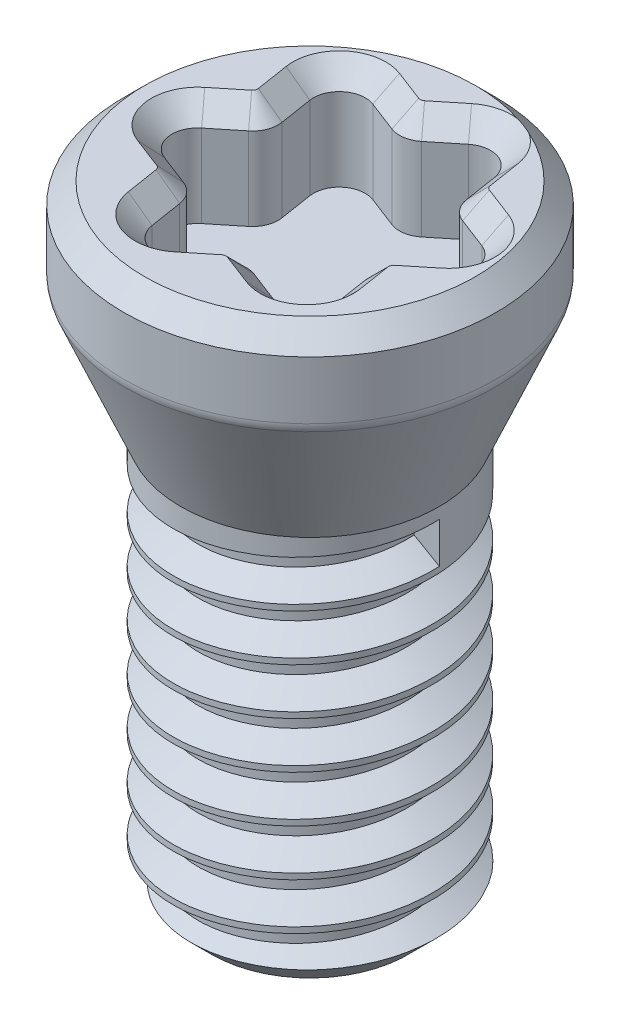
from build123d import *

# Parameters (mm, degrees)
FILETE1_R             = 0.2
CHANFRO1_SIZE         = 0.3
CORTE_EXTRUS_O1_DEPTH = 1
FILETE2_R             = 0.25
CHANFRO2_SIZE         = 0.2
ROSCA1_PITCH          = 0.45


with BuildPart() as part:
    # Esboço1 → Revolução1 (revolve)
    with BuildSketch(Plane.XY, mode=Mode.PRIVATE) as revolu_o1_sk:
        Polygon((0, 0), (1.25, 0), (1.25, 3.9), (1.8, 5.2), (1.8, 6), (0, 6), align=None)
    revolve(revolu_o1_sk.sketch.rotate(Axis((0, 0, 0), (0, 1, 0)), 90), axis=Axis((0, 0, 0), (0, 1, 0)))

    # Filete1
    filete1_edges = [part.edges().sort_by_distance(p)[0] for p in [
        (0, 5.2, 1.8),
    ]]
    fillet(filete1_edges, radius=FILETE1_R)

    # Chanfro1
    chanfro1_edges = [part.edges().sort_by_distance(p)[0] for p in [
        (0, 0, 1.25),
    ]]
    chamfer(chanfro1_edges, length=CHANFRO1_SIZE)

    # Esboço2 → Corte-extrusão1 (cut)
    with BuildSketch(Plane(origin=(0, 6, 0), x_dir=(1, 0, 0), z_dir=(0, 1, 0))):
        Polygon((1.574906763, 0.33480894), (-0.524001874, -1.36359694), (-0.945410194, 1.3033142), align=None)
        Polygon((0.594331671, 1.546614407), (1.015739991, -1.120296733), (-1.504576966, -0.151791473), align=None)
        Polygon((-0.804940754, 0.41434382), (-1.504576966, -0.151791473), (-0.664471314, -0.47462656), align=None)
        Polygon((0.175634338, -0.797461646), (-0.664471314, -0.47462656), (-0.524001874, -1.36359694), align=None)
        Polygon((0.875270551, -0.231326353), (0.175634338, -0.797461646), (1.015739991, -1.120296733), align=None)
        Polygon((1.574906763, 0.33480894), (0.734801111, 0.657644027), (0.875270551, -0.231326353), align=None)
        Polygon((0.594331671, 1.546614407), (-0.105304542, 0.980479113), (0.734801111, 0.657644027), align=None)
        Polygon((-0.945410194, 1.3033142), (-0.804940754, 0.41434382), (-0.105304542, 0.980479113), align=None)
    extrude(amount=-CORTE_EXTRUS_O1_DEPTH, mode=Mode.SUBTRACT)

    # Filete2
    filete2_edges = [part.edges().sort_by_distance(p)[0] for p in [
        (0.175634338, 5.5, 0.797461646),
        (-0.524001874, 5.5, 1.36359694),
        (-0.664471314, 5.5, 0.47462656),
        (-1.504576966, 5.5, 0.151791473),
        (-0.804940754, 5.5, -0.41434382),
        (-0.945410194, 5.5, -1.3033142),
        (-0.105304542, 5.5, -0.980479113),
        (0.594331671, 5.5, -1.546614407),
        (0.734801111, 5.5, -0.657644027),
        (1.574906763, 5.5, -0.33480894),
        (0.875270551, 5.5, 0.231326353),
        (1.015739991, 5.5, 1.120296733),
    ]]
    fillet(filete2_edges, radius=FILETE2_R)

    # Chanfro2
    # the kernel refuses this chamfer: 0.2 mm, written as the material it takes off along each edge
    with BuildSketch(Plane(origin=(0, 6, 0), x_dir=(0, 0, -1), z_dir=(1, 0, 0))) as chanfro2_piece_1:
        Polygon((1.8 - CHANFRO2_SIZE, 0), (1.8, -CHANFRO2_SIZE), (1.8, 0), align=None)
    revolve(axis=Axis((0, 6, 0), (0, 1, 0)), mode=Mode.SUBTRACT)
    with BuildSketch(Plane(origin=(-0.827468551, 6, -0.556912511), x_dir=(-0.9873714169859867, 0.02749587661058733, 0.1560181453821959), z_dir=(-0.15607715551522913, 0, -0.9877448666160078)), Plane(origin=(-0.541214173, 6, -1.147990097), x_dir=(0.35857003114067887, 0.027495876610587354, -0.9330978027716001), z_dir=(0.9334507247047489, 0, 0.3587056516814019)), Plane(origin=(-0.799203321, 6, 0.422851859), x_dir=(-0.3585700311406784, 0.027495876610587357, 0.9330978027716003), z_dir=(-0.933450724704749, 0, -0.35870565168140145)), Plane(origin=(-1.167964337, 6, -0.120590497), x_dir=(-0.6288013858453075, 0.02749587661058735, -0.7770796573894057), z_dir=(0.7773735691895212, 0, -0.6290392149346055)), Plane(origin=(0.063430128, 6, 0.888255636), x_dir=(0.6288013858453081, 0.027495876610587344, 0.7770796573894051), z_dir=(-0.7773735691895207, 0, 0.6290392149346061)), Plane(origin=(-0.591585265, 6, 0.935890866), x_dir=(-0.9873714169859867, 0.02749587661058736, 0.1560181453821959), z_dir=(-0.15607715551522913, 0, -0.9877448666160078)), Plane(origin=(0.897798348, 6, 0.373895044), x_dir=(0.9873714169859867, 0.02749587661058733, -0.15601814538219608), z_dir=(0.15607715551522933, 0, 0.9877448666160078)), Plane(origin=(0.61154397, 6, 0.96497263), x_dir=(-0.3585700311406784, 0.027495876610587357, 0.9330978027716003), z_dir=(-0.933450724704749, 0, -0.35870565168140145)), Plane(origin=(0.006899668, 6, -1.071273103), x_dir=(-0.6288013858453074, 0.027495876610587357, -0.7770796573894057), z_dir=(0.7773735691895212, 0, -0.6290392149346055)), Plane(origin=(0.661915062, 6, -1.118908333), x_dir=(0.9873714169859867, 0.02749587661058736, -0.1560181453821961), z_dir=(0.15607715551522933, 0, 0.9877448666160078)), Plane(origin=(0.869533117, 6, -0.605869326), x_dir=(0.35857003114067887, 0.027495876610587354, -0.9330978027716001), z_dir=(0.9334507247047489, 0, 0.3587056516814019)), Plane(origin=(1.238294133, 6, -0.06242697), x_dir=(0.6288013858453081, 0.027495876610587357, 0.7770796573894051), z_dir=(-0.7773735691895207, 0, 0.6290392149346061))) as chanfro2_piece_2:
        Polygon((CHANFRO2_SIZE * 0.999621916911, -CHANFRO2_SIZE * 0.0274958766106), (-CHANFRO2_SIZE * 0.0274958766106, -CHANFRO2_SIZE * 0.999621916911), (0, 0), align=None)
    extrude(amount=0.322649731, mode=Mode.SUBTRACT)
    with BuildSketch(Plane(origin=(-0.150360135, 6, -1.265616496), x_dir=(0.6290392149346056, 0, 0.7773735691895212), z_dir=(0.7773735691895212, 0, -0.6290392149346056))) as chanfro2_piece_3:
        Polygon((0.25 - CHANFRO2_SIZE, 0), (0.25, CHANFRO2_SIZE), (0.25, 0), align=None)
    revolve(axis=Axis((-0.150360135, 6, -1.265616496), (0, -1, 0)), revolution_arc=60, mode=Mode.SUBTRACT)
    with BuildSketch(Plane(origin=(-1.074404767, 6, -0.517893222), x_dir=(0.9877448666160078, 0, -0.1560771555152294), z_dir=(-0.1560771555152294, 0, -0.9877448666160078))) as chanfro2_piece_4:
        Polygon((0.25 - CHANFRO2_SIZE, 0), (0.25, CHANFRO2_SIZE), (0.25, 0), align=None)
    revolve(axis=Axis((-1.074404767, 6, -0.517893222), (0, -1, 0)), revolution_arc=60, mode=Mode.SUBTRACT)
    with BuildSketch(Plane(origin=(0.95920953, 6, -0.839232007), x_dir=(-0.35870565168140184, 0, 0.9334507247047489), z_dir=(0.9334507247047489, 0, 0.35870565168140184))) as chanfro2_piece_5:
        Polygon((0.25 - CHANFRO2_SIZE, 0), (0.25, CHANFRO2_SIZE), (0.25, 0), align=None)
    revolve(axis=Axis((0.95920953, 6, -0.839232007), (0, -1, 0)), revolution_arc=60, mode=Mode.SUBTRACT)
    with BuildSketch(Plane(origin=(1.144734564, 6, 0.334875755), x_dir=(-0.9877448666160077, 0, 0.15607715551522985), z_dir=(0.15607715551522985, 0, 0.9877448666160077))) as chanfro2_piece_6:
        Polygon((0.25 - CHANFRO2_SIZE, 0), (0.25, CHANFRO2_SIZE), (0.25, 0), align=None)
    revolve(axis=Axis((1.144734564, 6, 0.334875755), (0, -1, 0)), revolution_arc=60, mode=Mode.SUBTRACT)
    with BuildSketch(Plane(origin=(0.220689932, 6, 1.082599029), x_dir=(-0.6290392149346063, 0, -0.7773735691895205), z_dir=(-0.7773735691895205, 0, 0.6290392149346063))) as chanfro2_piece_7:
        Polygon((0.25 - CHANFRO2_SIZE, 0), (0.25, CHANFRO2_SIZE), (0.25, 0), align=None)
    revolve(axis=Axis((0.220689932, 6, 1.082599029), (0, -1, 0)), revolution_arc=60, mode=Mode.SUBTRACT)
    with BuildSketch(Plane(origin=(-0.888879734, 6, 0.65621454), x_dir=(0.3587056516814014, 0, -0.9334507247047491), z_dir=(-0.9334507247047491, 0, -0.3587056516814014))) as chanfro2_piece_8:
        Polygon((0.25 - CHANFRO2_SIZE, 0), (0.25, CHANFRO2_SIZE), (0.25, 0), align=None)
    revolve(axis=Axis((-0.888879734, 6, 0.65621454), (0, -1, 0)), revolution_arc=60, mode=Mode.SUBTRACT)
    with BuildSketch(Plane(origin=(-0.630890586, 6, -0.914627415), x_dir=(0.3587056516814027, 0, -0.9334507247047485), z_dir=(0.9334507247047485, 0, 0.3587056516814027))) as chanfro2_piece_9:
        Polygon((0.25 + CHANFRO2_SIZE, 0), (0.25, -CHANFRO2_SIZE), (0.25, 0), align=None)
    revolve(axis=Axis((-0.630890586, 6, -0.914627415), (0, 1, 0)), revolution_arc=120, mode=Mode.SUBTRACT)
    with BuildSketch(Plane(origin=(-1.010704533, 6, 0.073752896), x_dir=(-0.6290392149346057, 0, -0.7773735691895209), z_dir=(0.7773735691895209, 0, -0.6290392149346057))) as chanfro2_piece_10:
        Polygon((0.25 + CHANFRO2_SIZE, 0), (0.25, -CHANFRO2_SIZE), (0.25, 0), align=None)
    revolve(axis=Axis((-1.010704533, 6, 0.073752896), (0, 1, 0)), revolution_arc=120, mode=Mode.SUBTRACT)
    with BuildSketch(Plane(origin=(-0.344649048, 6, 0.896871578), x_dir=(-0.9877448666160078, 0, 0.15607715551522894), z_dir=(-0.15607715551522894, 0, -0.9877448666160078))) as chanfro2_piece_11:
        Polygon((0.25 + CHANFRO2_SIZE, 0), (0.25, -CHANFRO2_SIZE), (0.25, 0), align=None)
    revolve(axis=Axis((-0.344649048, 6, 0.896871578), (0, 1, 0)), revolution_arc=120, mode=Mode.SUBTRACT)
    with BuildSketch(Plane(origin=(0.701220383, 6, 0.731609948), x_dir=(-0.35870565168140134, 0, 0.9334507247047492), z_dir=(-0.9334507247047492, 0, -0.35870565168140134))) as chanfro2_piece_12:
        Polygon((0.25 + CHANFRO2_SIZE, 0), (0.25, -CHANFRO2_SIZE), (0.25, 0), align=None)
    revolve(axis=Axis((0.701220383, 6, 0.731609948), (0, 1, 0)), revolution_arc=120, mode=Mode.SUBTRACT)
    with BuildSketch(Plane(origin=(1.08103433, 6, -0.256770363), x_dir=(0.3587056516814009, 0, -0.9334507247047492), z_dir=(-0.9334507247047492, 0, -0.3587056516814009))) as chanfro2_piece_13:
        Polygon((0.25 + CHANFRO2_SIZE, 0), (0.25, CHANFRO2_SIZE), (0.25, 0), align=None)
    revolve(axis=Axis((1.08103433, 6, -0.256770363), (0, -1, 0)), revolution_arc=120, mode=Mode.SUBTRACT)
    with BuildSketch(Plane(origin=(0.414978845, 6, -1.079889045), x_dir=(0.9877448666160078, 0, -0.1560771555152289), z_dir=(0.1560771555152289, 0, 0.9877448666160078))) as chanfro2_piece_14:
        Polygon((0.25 + CHANFRO2_SIZE, 0), (0.25, -CHANFRO2_SIZE), (0.25, 0), align=None)
    revolve(axis=Axis((0.414978845, 6, -1.079889045), (0, 1, 0)), revolution_arc=120, mode=Mode.SUBTRACT)

    # Rosca1: the profile of Perfil da rosca1 profile screwed along a right-hand helix of 8 turns, 6 arcs to a turn; built about Z, then put on its axis
    rosca1_z = Axis((0, 0, 0), (0, 0, 1))
    rosca1_corners = [(1.2503, 0, -0.000173205), (1.2503, 0, 0.393923204), (1.006430356, 0, 0.253124999), (1.006430356, 0, 0.140624999)]
    with BuildLine(mode=Mode.PRIVATE) as rosca1_profile:
        Line(rosca1_corners[0], rosca1_corners[1])
        Line(rosca1_corners[1], rosca1_corners[2])
        Line(rosca1_corners[2], rosca1_corners[3])
        Line(rosca1_corners[3], rosca1_corners[0])
    rosca1_cap = Face(rosca1_profile.wire())
    rosca1_turn_angles = [0, 30, 60, 90, 120, 150, 180, 210, 240, 270, 300, 330, 360]
    rosca1_turn_weights = [1, 0.8660254037844387, 1, 0.8660254037844387, 1, 0.8660254037844387, 1, 0.8660254037844387, 1, 0.8660254037844387, 1, 0.8660254037844387, 1]
    rosca1_turn_rails = [Edge.make_bspline([Vector(p[0], p[1], 0).rotate(rosca1_z, rosca1_turn_angles[k]) / rosca1_turn_weights[k] + Vector(0, 0, p[2] + ROSCA1_PITCH * rosca1_turn_angles[k] / 360) for k in range(13)], [0, 0, 0, 1, 1, 2, 2, 3, 3, 4, 4, 5, 5, 6, 6, 6], 2, rosca1_turn_weights) for p in rosca1_corners]
    rosca1_turn_sides = [Face.make_surface_from_curves(rosca1_turn_rails[p[0]], rosca1_turn_rails[p[1]]) for p in [(0, 1), (1, 2), (2, 3), (3, 0)]]
    rosca1 = Plane(origin=(0, -0.2, 0), x_dir=(1, 0, 0), z_dir=(0, 1, 0)) * Solid(Shell([*[p.moved(Location((0, 0, ROSCA1_PITCH * i))) for i in range(8) for p in rosca1_turn_sides], rosca1_cap, rosca1_cap.rotate(rosca1_z, 2880).moved(Location((0, 0, ROSCA1_PITCH * 2880 / 360)))]))
    add(rosca1, mode=Mode.SUBTRACT)


solid = part.part
